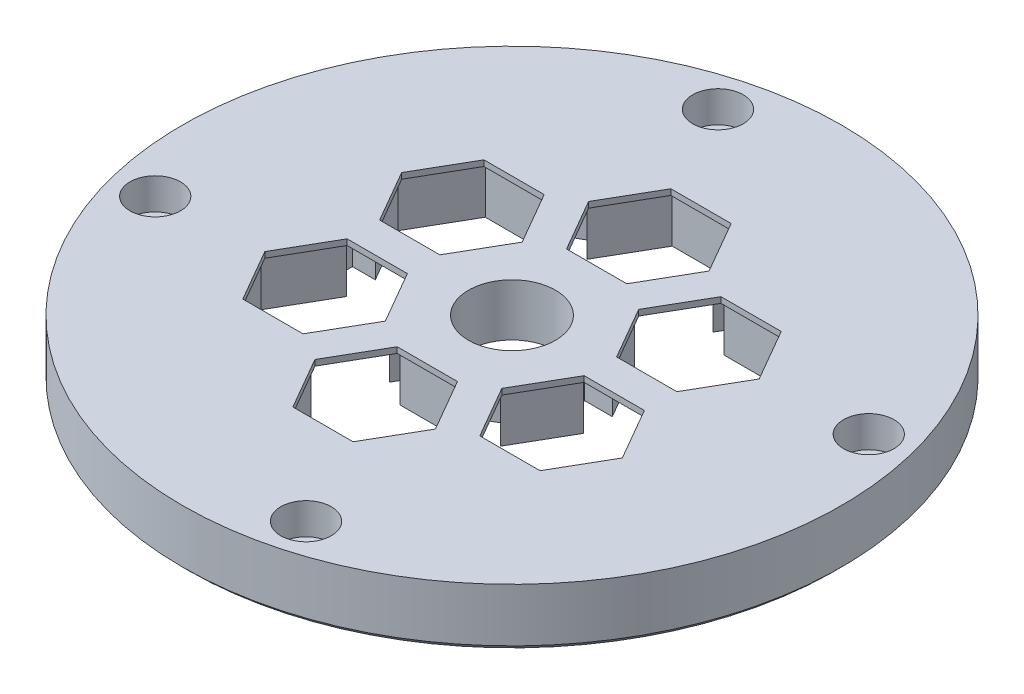
from build123d import *

# Parameters (mm, degrees)
SKETCH2_R           = 56.85
SKETCH2_R_2         = 44.5
BOSS_EXTRUDE1_DEPTH = 1.2
SKETCH3_R           = 56.85
BOSS_EXTRUDE2_DEPTH = 9
SKETCH4_R           = 2.65
CUT_EXTRUDE1_DEPTH  = 82.042488856
SKETCH5_R           = 7.5
CUT_EXTRUDE2_DEPTH  = 82.042488856
CUT_EXTRUDE4_DEPTH  = 81.900216316
SKETCH7_W           = 20
SKETCH7_H           = 5
BOSS_EXTRUDE3_DEPTH = 1
BOSS_EXTRUDE4_DEPTH = 1
CIRPATTERN1_COUNT   = 6
SKETCH9_R           = 4.35
CUT_EXTRUDE5_DEPTH  = 5.4
CHAMFER1_SIZE       = 1


with BuildPart() as part:
    # Sketch2 → Boss-Extrude1 (new body)
    with BuildSketch(Plane(origin=(0, 0, 0), x_dir=(1, 0, 0), z_dir=(0, 1, 0))):
        Circle(SKETCH2_R)
        Circle(SKETCH2_R_2, mode=Mode.SUBTRACT)
    extrude(amount=BOSS_EXTRUDE1_DEPTH)

    # Sketch3 → Boss-Extrude2 (add)
    with BuildSketch(Plane(origin=(0, 1.2, 0), x_dir=(1, 0, 0), z_dir=(0, 1, 0))):
        Circle(SKETCH3_R)
    extrude(amount=BOSS_EXTRUDE2_DEPTH)

    # Sketch4 → Cut-Extrude1 (cut, through all)
    with BuildSketch(Plane(origin=(0, 10.2, 0), x_dir=(1, 0, 0), z_dir=(0, 1, 0))):
        with Locations((-13.005657016, 48.537772771)):
            Circle(SKETCH4_R)
        with Locations((48.537772771, 13.005657016)):
            Circle(SKETCH4_R)
        with Locations((13.005657016, -48.537772771)):
            Circle(SKETCH4_R)
        with Locations((-48.537772771, -13.005657016)):
            Circle(SKETCH4_R)
    extrude(amount=-CUT_EXTRUDE1_DEPTH, mode=Mode.SUBTRACT)

    # Sketch5 → Cut-Extrude2 (cut, through all)
    with BuildSketch(Plane(origin=(0, 10.2, 0), x_dir=(1, 0, 0), z_dir=(0, 1, 0))):
        Circle(SKETCH5_R)
    extrude(amount=-CUT_EXTRUDE2_DEPTH, mode=Mode.SUBTRACT)

    # Sketch6 → Cut-Extrude4 (cut, through all)
    with BuildSketch(Plane.XZ.offset(-1.2)):
        Polygon((12.845675931, 27.249363369), (10.876265015, 23.838243602), (5.505548638, 33.14059724), (-5.505548638, 33.14059724), (-10.876265015, 23.838243603), (-12.845675931, 27.249363369), (-17.175802949, 24.749363369), (-15.206392034, 21.338243603), (-25.947824787, 21.338243603), (-31.453373426, 11.802353637), (-26.082657049, 2.5), (-30.02147888, 2.5), (-30.02147888, -2.5), (-26.082657049, -2.5), (-31.453373426, -11.802353638), (-25.947824787, -21.338243603), (-15.206392034, -21.338243603), (-17.175802949, -24.749363369), (-12.845675931, -27.249363369), (-10.876265015, -23.838243603), (-5.505548638, -33.14059724), (5.505548638, -33.14059724), (10.876265015, -23.838243603), (12.845675931, -27.249363369), (17.175802949, -24.749363369), (15.206392034, -21.338243603), (25.947824787, -21.338243603), (31.453373426, -11.802353638), (26.082657049, -2.5), (30.02147888, -2.5), (30.02147888, 2.5), (26.082657049, 2.5), (31.453373426, 11.802353637), (25.947824787, 21.338243602), (15.206392034, 21.338243602), (17.175802949, 24.749363369), align=None)
        Polygon((-2.845675931, 9.928855294), (-5.235884115, 14.06881731), (5.235884115, 14.06881731), (2.845675931, 9.928855294), (7.175802949, 7.428855294), (9.566011134, 11.56881731), (14.801895249, 2.5), (10.02147888, 2.5), (10.02147888, -2.5), (14.801895249, -2.5), (9.566011134, -11.56881731), (7.175802949, -7.428855294), (2.845675931, -9.928855294), (5.235884115, -14.06881731), (-5.235884115, -14.06881731), (-2.845675931, -9.928855294), (-7.175802949, -7.428855294), (-9.566011134, -11.56881731), (-14.801895249, -2.5), (-10.02147888, -2.5), (-10.02147888, 2.5), (-14.801895249, 2.5), (-9.566011134, 11.56881731), (-7.175802949, 7.428855294), align=None, mode=Mode.SUBTRACT)
    extrude(amount=-CUT_EXTRUDE4_DEPTH, mode=Mode.SUBTRACT)


with BuildPart() as cut_extrude4_piece_1:
    # of the separate pieces the step leaves, piece 1, a body of its own (cut_extrude4_pieces)
    add(part.part.solids().sort_by_distance((56.85, 0, 0))[0])



with BuildPart() as cut_extrude4_piece_2:
    # of the separate pieces the step leaves, piece 2, a body of its own (cut_extrude4_pieces)
    add(part.part.solids().sort_by_distance((-14.801895249, 10.2, 2.5))[0])


with BuildPart() as cut_extrude4_piece_1_1:
    add(cut_extrude4_piece_1.part)

    add(cut_extrude4_piece_2.part)  # Boss-Extrude3 merges Cut-Extrude4 piece 2
    # Sketch7 → Boss-Extrude3 (add)
    with BuildSketch(Plane(origin=(0, 10.2, 0), x_dir=(1, 0, 0), z_dir=(0, 1, 0))):
        Polygon((-17.175802949, 24.749363369), (-7.175802949, 7.428855294), (-2.845675931, 9.928855294), (-12.845675931, 27.249363369), align=None)
        Polygon((17.175802949, 24.749363369), (12.845675931, 27.249363369), (2.845675931, 9.928855294), (7.175802949, 7.428855294), align=None)
        with Locations((20.02147888, 0)):
            Rectangle(SKETCH7_W, SKETCH7_H)
        Polygon((12.845675931, -27.249363369), (17.175802949, -24.749363369), (7.175802949, -7.428855294), (2.845675931, -9.928855294), align=None)
        Polygon((-17.175802949, -24.749363369), (-12.845675931, -27.249363369), (-2.845675931, -9.928855294), (-7.175802949, -7.428855294), align=None)
        with Locations((-20.02147888, 0)):
            Rectangle(SKETCH7_W, SKETCH7_H)
    extrude(amount=-BOSS_EXTRUDE3_DEPTH)

    # Sketch8 → Boss-Extrude4 (add)
    with BuildSketch(Plane(origin=(0, 10.2, 0), x_dir=(1, 0, 0), z_dir=(0, 1, 0))):
        Polygon((5.542562584, -14.00470728), (-5.542562584, -14.00470728), (-11.085125168, -23.60470728), (-5.542562584, -33.20470728), (5.542562584, -33.20470728), (11.085125168, -23.60470728), align=None)
        Polygon((5.196152423, -14.60470728), (-5.196152423, -14.60470728), (-10.392304845, -23.60470728), (-5.196152423, -32.60470728), (5.196152423, -32.60470728), (10.392304845, -23.60470728), align=None, mode=Mode.SUBTRACT)
    boss_extrude4 = extrude(amount=-BOSS_EXTRUDE4_DEPTH)

    # CirPattern1: Boss-Extrude4 ×6 about axis
    cirpattern1_axis = Axis((0, 0, 0), (0, 1, 0))
    for i in range(1, CIRPATTERN1_COUNT):
        add(boss_extrude4.rotate(cirpattern1_axis, i * 360 / CIRPATTERN1_COUNT))

    # Sketch9 → Cut-Extrude5 (cut)
    with BuildSketch(Plane(origin=(0, 10.2, 0), x_dir=(1, 0, 0), z_dir=(0, 1, 0))):
        with Locations((-13.005657016, 48.537772771)):
            Circle(SKETCH9_R)
        with Locations((48.537772771, 13.005657016)):
            Circle(SKETCH9_R)
        with Locations((13.005657016, -48.537772771)):
            Circle(SKETCH9_R)
        with Locations((-48.537772771, -13.005657016)):
            Circle(SKETCH9_R)
    extrude(amount=-CUT_EXTRUDE5_DEPTH, mode=Mode.SUBTRACT)

    # Chamfer1
    chamfer1_edges = [cut_extrude4_piece_1_1.edges().sort_by_distance(p)[0] for p in [
        (-44.5, 0, 0),
        (-56.85, 0, 0),
    ]]
    chamfer(chamfer1_edges, length=CHAMFER1_SIZE)


solid = cut_extrude4_piece_1_1.part
